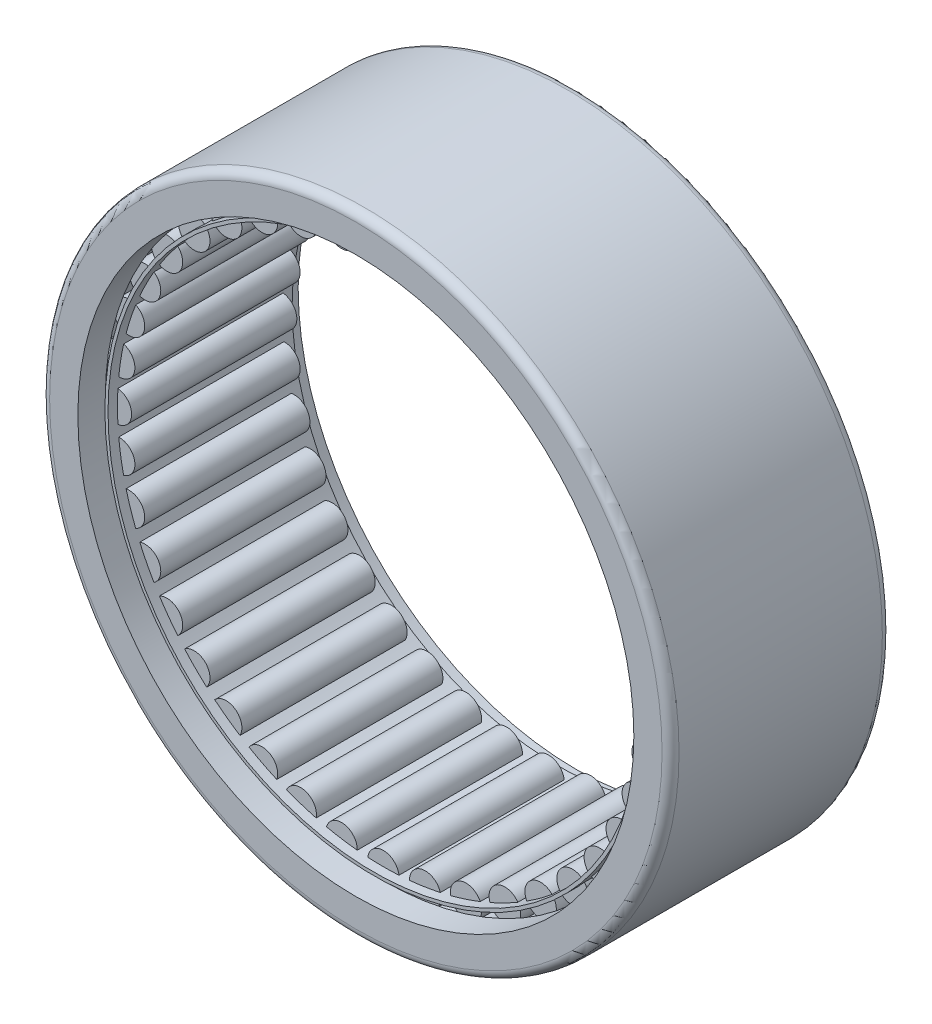
from build123d import *

# Parameters (mm, degrees)
BASESKE_W            = 26.25
BASESKE_H            = 2.5
CAGESKE_W            = 29.25
CAGESKE_H            = 0.5
FILLET1_R            = 1.35
CIRPATTERNBALL_COUNT = 40


with BuildPart() as part:
    # BaseSke → Roller (revolve)
    with BuildSketch(Plane(origin=(0, 0, 0), x_dir=(0, 0, -1), z_dir=(1, 0, 0))):
        with Locations((0, 41.25)):
            Rectangle(BASESKE_W, BASESKE_H)
    roller = revolve(axis=Axis((0, 42.5, 13.125), (0, 0, -1)))

    # OuterRaceSke → OuterRace (revolve)
    with BuildSketch(Plane(origin=(0, 0, 0), x_dir=(0, 0, -1), z_dir=(1, 0, 0))):
        Polygon((-17.5, 50), (17.5, 50), (17.5, 44.166666667), (13.15, 44.166666667), (13.15, 44.98), (-13.15, 44.98), (-13.15, 44.166666667), (-17.5, 44.166666667), align=None)
    revolve(axis=Axis((0, 0, 50.391616343), (0, 0, -1)))

    # CageSke → Cage (revolve)
    with BuildSketch(Plane(origin=(0, 0, 0), x_dir=(0, 0, -1), z_dir=(1, 0, 0))):
        with Locations((0, 42.5)):
            Rectangle(CAGESKE_W, CAGESKE_H)
    revolve(axis=Axis((0, 0, 70.862590906), (0, 0, -1)))

    # Fillet1
    fillet1_edges = [part.edges().sort_by_distance(p)[0] for p in [
        (0, -50, -17.5),
        (0, -50, 17.5),
    ]]
    fillet(fillet1_edges, radius=FILLET1_R)

    # CirPatternBall: Roller ×40 about axis
    cirpatternball_axis = Axis((0, 0, 50.391616343), (0, 0, -1))
    for i in range(1, CIRPATTERNBALL_COUNT):
        add(roller.rotate(cirpatternball_axis, i * 360 / CIRPATTERNBALL_COUNT))


solid = part.part
